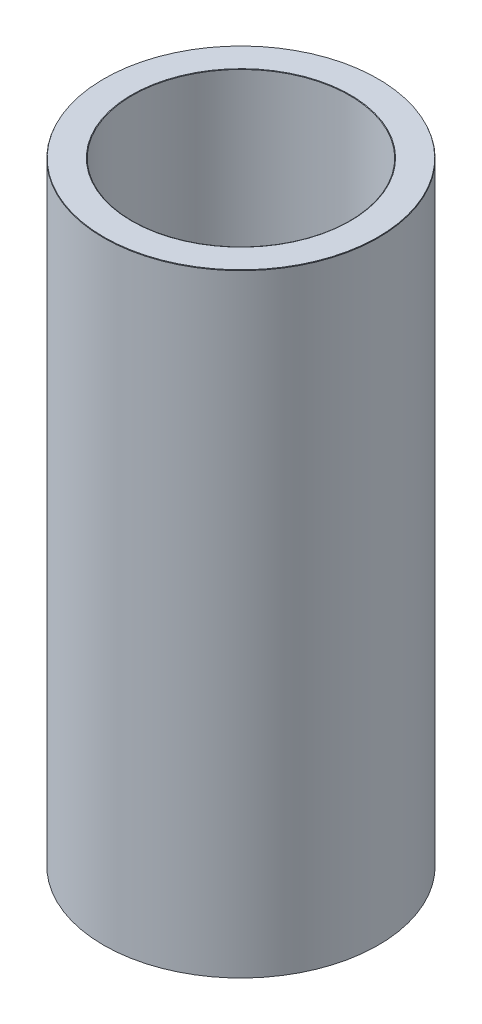
from build123d import *
from OCP.BRepFilletAPI import BRepFilletAPI_MakeChamfer

# Parameters (mm, degrees)
SKETCH1_R           = 57.5
BOSS_EXTRUDE1_DEPTH = 256.852065351
SKETCH2_R           = 45.534341985
CUT_EXTRUDE1_DEPTH  = 270.41693242
CHAMFER1_SIZE       = 0.245595986
CHAMFER1_SIZE2      = 0.111467159


with BuildPart() as part:
    # Sketch1 → Boss-Extrude1 (new body)
    with BuildSketch(Plane(origin=(0, 0, 0), x_dir=(1, 0, 0), z_dir=(0, 1, 0))):
        Circle(SKETCH1_R)
    extrude(amount=BOSS_EXTRUDE1_DEPTH)

    # Sketch2 → Cut-Extrude1 (cut, through all)
    with BuildSketch(Plane(origin=(0, 0, 0), x_dir=(1, 0, 0), z_dir=(0, 1, 0))):
        Circle(SKETCH2_R)
    extrude(amount=CUT_EXTRUDE1_DEPTH, mode=Mode.SUBTRACT)

    # Chamfer1: one chamfer whose edges measure the first distance from different faces: ONE call of the kernel's chamfer builder (chamfer() names one face for all edges)
    chamfer1_edges_1 = [part.edges().sort_by_distance(p)[0] for p in [
        (-45.534341985, 256.852065351, 0),
    ]]
    chamfer1_side_1 = [part.faces().sort_by_distance(p)[0] for p in [
        (-55.873654403, 256.852065351, 0),
    ]]
    chamfer1_edges_2 = [part.edges().sort_by_distance(p)[0] for p in [
        (-45.534341985, 0, 0),
    ]]
    chamfer1_side_2 = [part.faces().sort_by_distance(p)[0] for p in [
        (-45.534341985, 128.426032675, 0),
    ]]
    chamfer1_edges_3 = [part.edges().sort_by_distance(p)[0] for p in [
        (-57.5, 0, 0),
    ]]
    chamfer1_side_3 = [part.faces().sort_by_distance(p)[0] for p in [
        (-55.873654403, 0, 0),
    ]]
    chamfer1_edges_4 = [part.edges().sort_by_distance(p)[0] for p in [
        (-57.5, 256.852065351, 0),
    ]]
    chamfer1_side_4 = [part.faces().sort_by_distance(p)[0] for p in [
        (-57.5, 128.426032675, 0),
    ]]
    chamfer1 = BRepFilletAPI_MakeChamfer(part.part.solid().wrapped)
    for e in chamfer1_edges_1:
        chamfer1.Add(CHAMFER1_SIZE, CHAMFER1_SIZE2, e.wrapped, chamfer1_side_1[0].wrapped)  # the first distance lies on this face
    for e in chamfer1_edges_2:
        chamfer1.Add(CHAMFER1_SIZE, CHAMFER1_SIZE2, e.wrapped, chamfer1_side_2[0].wrapped)  # the first distance lies on this face
    for e in chamfer1_edges_3:
        chamfer1.Add(CHAMFER1_SIZE, CHAMFER1_SIZE2, e.wrapped, chamfer1_side_3[0].wrapped)  # the first distance lies on this face
    for e in chamfer1_edges_4:
        chamfer1.Add(CHAMFER1_SIZE, CHAMFER1_SIZE2, e.wrapped, chamfer1_side_4[0].wrapped)  # the first distance lies on this face
    add(Compound.cast(chamfer1.Shape()), mode=Mode.REPLACE)


solid = part.part
